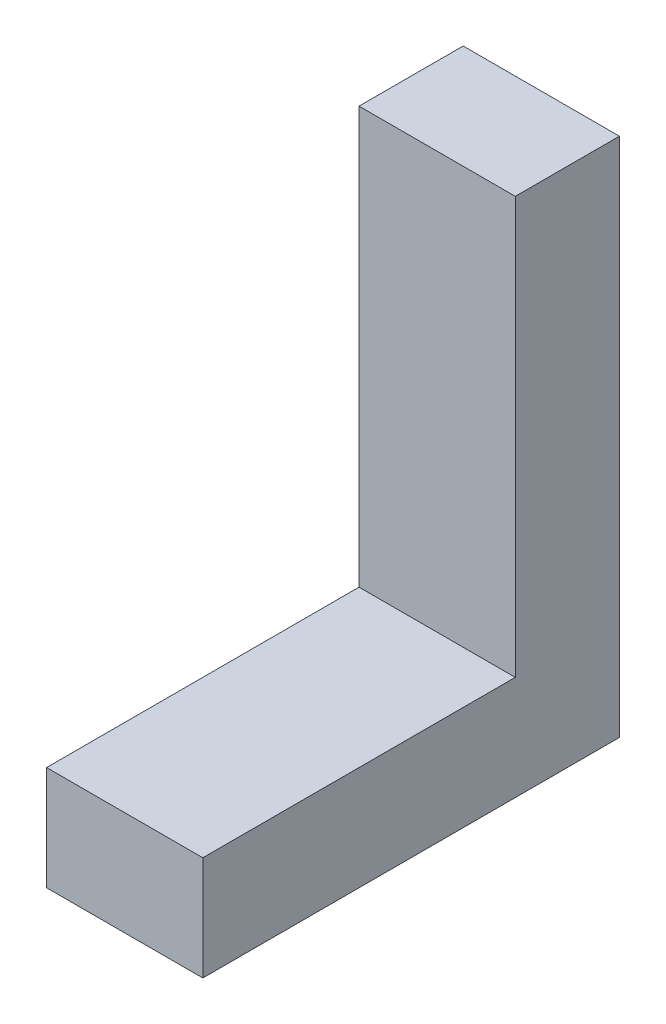
from build123d import *

# Parameters (mm, degrees)
BOSS_EXTRUDE1_DEPTH = 15


with BuildPart() as part:
    # Sketch1 → Boss-Extrude1 (new body)
    with BuildSketch(Plane(origin=(0, 0, 0), x_dir=(0, 0, -1), z_dir=(1, 0, 0))):
        Polygon((0, 0), (-40, 0), (-40, 10), (-10, 10), (-10, 50), (0, 50), align=None)
    extrude(amount=BOSS_EXTRUDE1_DEPTH)


solid = part.part
